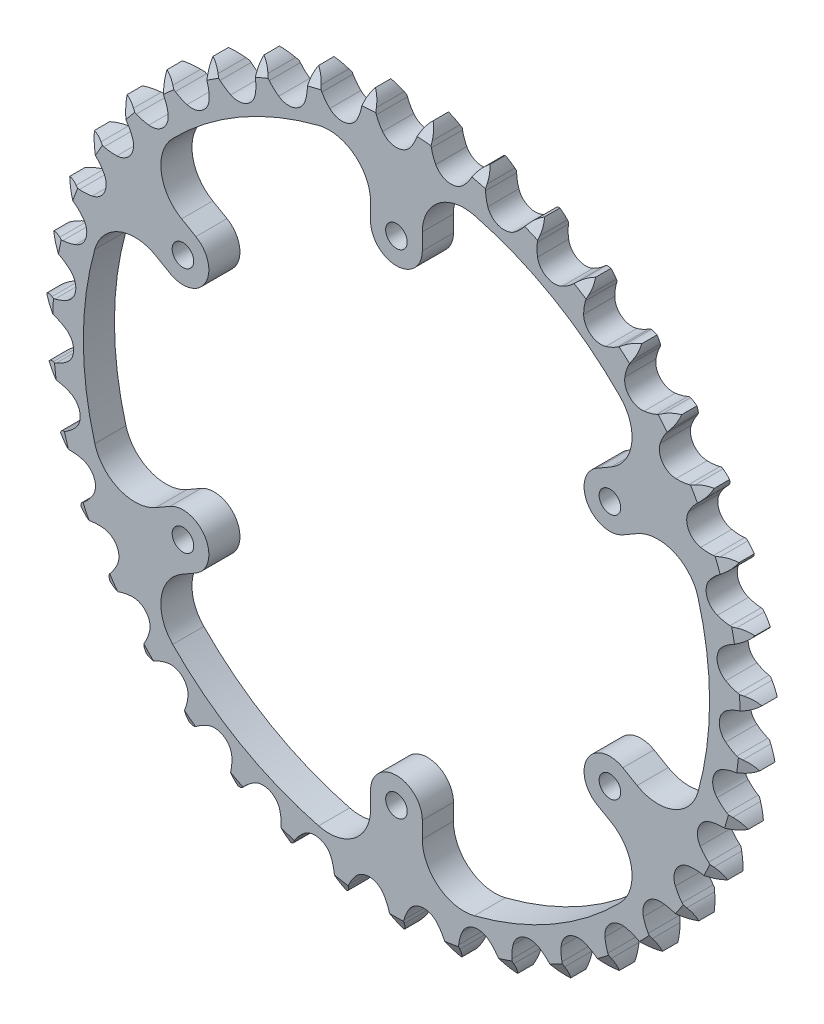
from build123d import *

# Parameters (mm, degrees)
EXTRUSION_DEPTH         = 7.2136
CUT_EXTRUDE_DEPTH       = 118.514389318
CUT_EXTRUDE_DEPTH_BACK  = 118.514389318
SKETCH1_R               = 72.594294032
BOSS_EXTRUDE_DEPTH      = 7.2136
M5_COUNTER_BORE_D       = 5
BOLT_HOLE_PATTERN_COUNT = 6
SKETCH6_R               = 5
CUT_EXTRUDE1_DEPTH      = 1.5
CIRPATTERN1_COUNT       = 6


with BuildPart() as part:
    # Teeth Sketch → Extrusion (new body)
    with BuildSketch(Plane.XY):
        with BuildLine():
            ThreePointArc((6.676484762, 82.703103732), (5.710873677, 81.555589606), (5.037571935, 80.215493266))
            Line((5.037571935, 80.215493266), (4.65053543, 79.150636707))
            ThreePointArc((4.65053543, 79.150636707), (4.030589042, 77.787636082), (3.22092759, 76.5280518))
            ThreePointArc((3.22092759, 76.5280518), (0, 74.905926143), (-3.22092759, 76.5280518))
            ThreePointArc((-3.22092759, 76.5280518), (-4.030589042, 77.787636082), (-4.65053543, 79.150636707))
            Line((-4.65053543, 79.150636707), (-5.037571935, 80.215493266))
            ThreePointArc((-5.037571935, 80.215493266), (-5.710873677, 81.555589606), (-6.676484762, 82.703103732))
            ThreePointArc((-6.676484762, 82.703103732), (-7.445517227, 81.415554702), (-7.895133318, 79.984807062))
            Line((-7.895133318, 79.984807062), (-8.106342797, 78.871655094))
            ThreePointArc((-8.106342797, 78.871655094), (-8.499620367, 77.426858575), (-9.096745387, 76.053706749))
            ThreePointArc((-9.096745387, 76.053706749), (-12.015755556, 73.935914073), (-15.455180235, 75.020360508))
            ThreePointArc((-15.455180235, 75.020360508), (-16.456408311, 76.133754674), (-17.286967233, 77.379658404))
            Line((-17.286967233, 77.379658404), (-17.83980672, 78.368640329))
            ThreePointArc((-17.83980672, 78.368640329), (-18.719355953, 79.583377579), (-19.856536839, 80.561136787))
            ThreePointArc((-19.856536839, 80.561136787), (-20.409073146, 79.166899696), (-20.623358765, 77.682556369))
            Line((-20.623358765, 77.682556369), (-20.653271004, 76.549939044))
            ThreePointArc((-20.653271004, 76.549939044), (-20.809694072, 75.060766102), (-21.178817437, 73.609610642))
            ThreePointArc((-21.178817437, 73.609610642), (-23.720309356, 71.051000665), (-27.289151829, 71.569681286))
            ThreePointArc((-27.289151829, 71.569681286), (-28.456015249, 72.508049011), (-29.475675664, 73.604587595))
            Line((-29.475675664, 73.604587595), (-30.179999883, 74.492080773))
            ThreePointArc((-30.179999883, 74.492080773), (-31.243016742, 75.549997876), (-32.522315041, 76.332678717))
            ThreePointArc((-32.522315041, 76.332678717), (-32.844044791, 74.867863573), (-32.817450053, 73.368368272))
            Line((-32.817450053, 73.368368272), (-32.66529034, 72.245619783))
            ThreePointArc((-32.66529034, 72.245619783), (-32.580807632, 70.750639215), (-32.71236924, 69.259064285))
            ThreePointArc((-32.71236924, 69.259064285), (-34.810519602, 66.325903661), (-38.416348726, 66.265384911))
            ThreePointArc((-38.416348726, 66.265384911), (-39.71862634, 67.004422965), (-40.900979579, 67.923196629))
            Line((-40.900979579, 67.923196629), (-41.738546902, 68.686215454))
            ThreePointArc((-41.738546902, 68.686215454), (-42.957499809, 69.559912912), (-44.345782367, 70.127244363))
            ThreePointArc((-44.345782367, 70.127244363), (-44.428372928, 68.629789109), (-44.161586623, 67.153977974))
            Line((-44.161586623, 67.153977974), (-43.831295815, 66.070176918))
            ThreePointArc((-43.831295815, 66.070176918), (-43.508095388, 64.608107935), (-43.398687863, 63.114744543))
            ThreePointArc((-43.398687863, 63.114744543), (-44.999155676, 59.883000591), (-48.54858237, 59.244849876))
            ThreePointArc((-48.54858237, 59.244849876), (-49.952545871, 59.765417561), (-51.266969607, 60.48263055))
            Line((-51.266969607, 60.48263055), (-52.21608748, 61.101413234))
            ThreePointArc((-52.21608748, 61.101413234), (-53.559406195, 61.768262742), (-55.020717224, 62.105551216))
            ThreePointArc((-55.020717224, 62.105551216), (-54.862029543, 60.614239157), (-54.361961296, 59.200334922))
            Line((-54.361961296, 59.200334922), (-53.862093752, 58.183551176))
            ThreePointArc((-53.862093752, 58.183551176), (-53.308546327, 56.792260597), (-52.961003266, 55.335786069))
            ThreePointArc((-52.961003266, 55.335786069), (-54.022337255, 51.889159262), (-57.423433231, 50.689904348))
            ThreePointArc((-57.423433231, 50.689904348), (-58.892720703, 50.978519235), (-60.305172051, 51.475596109))
            Line((-60.305172051, 51.475596109), (-61.34125882, 51.934116506))
            ThreePointArc((-61.34125882, 51.934116506), (-62.774152094, 52.376847013), (-64.270644405, 52.475356916))
            ThreePointArc((-64.270644405, 52.475356916), (-63.87478841, 51.02881225), (-63.154389727, 49.713434291))
            Line((-63.154389727, 49.713434291), (-62.497891753, 48.790002021))
            ThreePointArc((-62.497891753, 48.790002021), (-61.728333918, 47.505523541), (-61.151656504, 46.123659804))
            ThreePointArc((-61.151656504, 46.123659804), (-61.646368676, 42.551415963), (-64.811047336, 40.822116924))
            ThreePointArc((-64.811047336, 40.822116924), (-66.307605004, 40.871304038), (-67.781502216, 41.135370767))
            Line((-67.781502216, 41.135370767), (-68.877723777, 41.42175344))
            ThreePointArc((-68.877723777, 41.42175344), (-70.363080428, 41.628898458), (-71.855995657, 41.486078435))
            ThreePointArc((-71.855995657, 41.486078435), (-71.23322381, 40.12176591), (-70.311152637, 38.938981826))
            Line((-70.311152637, 38.938981826), (-69.515027187, 38.132817442))
            ThreePointArc((-69.515027187, 38.132817442), (-68.549390085, 36.988418379), (-67.75851396, 35.716954977))
            ThreePointArc((-67.75851396, 35.716954977), (-67.673791529, 32.111613343), (-70.520089358, 29.897058114))
            ThreePointArc((-70.520089358, 29.897058114), (-72.005157166, 29.705543536), (-73.502327078, 29.729760931))
            Line((-73.502327078, 29.729760931), (-74.630291869, 29.836588719))
            ThreePointArc((-74.630291869, 29.836588719), (-76.129641939, 29.8027833), (-77.580314364, 29.422332315))
            ThreePointArc((-77.580314364, 29.422332315), (-76.74675613, 28.175586908), (-75.646893627, 27.156030185))
            Line((-75.646893627, 27.156030185), (-74.731759931, 26.488012922))
            ThreePointArc((-74.731759931, 26.488012922), (-73.595053056, 25.51333261), (-72.610461496, 24.385199777))
            ThreePointArc((-72.610461496, 24.385199777), (-71.948498729, 20.840136804), (-74.402698108, 18.197681204))
            ThreePointArc((-74.402698108, 18.197681204), (-75.837813579, 17.77042506), (-77.319480277, 17.554165902))
            Line((-77.319480277, 17.554165902), (-78.449974603, 17.478672021))
            ThreePointArc((-78.449974603, 17.478672021), (-79.924485713, 17.204791709), (-81.295343681, 16.596563242))
            ThreePointArc((-81.295343681, 16.596563242), (-80.27258778, 15.499675005), (-79.023419807, 14.669751627))
            Line((-79.023419807, 14.669751627), (-78.012979347, 14.15718278))
            ThreePointArc((-78.012979347, 14.15718278), (-76.734642811, 13.377464928), (-75.58183622, 12.421880712))
            ThreePointArc((-75.58183622, 12.421880712), (-74.359777605, 9.028911669), (-76.358316059, 6.026993909))
            ThreePointArc((-76.358316059, 6.026993909), (-77.706310456, 5.375061909), (-79.134099551, 4.923927198))
            Line((-79.134099551, 4.923927198), (-80.237844202, 4.6680669))
            ThreePointArc((-80.237844202, 4.6680669), (-81.649327289, 4.161205049), (-82.904866299, 3.340951899))
            ThreePointArc((-82.904866299, 3.340951899), (-81.719401571, 2.422329661), (-80.353280924, 1.803534207))
            Line((-80.353280924, 1.803534207), (-79.273703577, 1.45968904))
            ThreePointArc((-79.273703577, 1.45968904), (-77.886845624, 0.895127931), (-76.595681088, 0.136841462))
            ThreePointArc((-76.595681088, 0.136841462), (-74.8451773, -3.016157536), (-76.336293733, -6.299789363))
            ThreePointArc((-76.336293733, -6.299789363), (-77.56225471, -7.159512522), (-78.899187214, -7.833838635))
            Line((-78.899187214, -7.833838635), (-79.947595784, -8.263438702))
            ThreePointArc((-79.947595784, -8.263438702), (-81.259494176, -8.990154635), (-82.367196428, -10.001188343))
            ThreePointArc((-82.367196428, -10.001188343), (-81.049725787, -10.717752749), (-79.602034272, -11.109393802))
            Line((-79.602034272, -11.109393802), (-78.481280524, -11.275609878))
            ThreePointArc((-78.481280524, -11.275609878), (-77.021820047, -11.610392409), (-75.625738049, -12.151741911))
            ThreePointArc((-75.625738049, -12.151741911), (-73.392126218, -14.983109845), (-74.337201497, -18.463411399))
            ThreePointArc((-74.337201497, -18.463411399), (-75.409377308, -19.50865934), (-76.620827372, -20.388712162))
            Line((-76.620827372, -20.388712162), (-77.586746629, -20.980925582))
            ThreePointArc((-77.586746629, -20.980925582), (-78.765082849, -21.908674036), (-79.696259435, -23.08430306))
            ThreePointArc((-79.696259435, -23.08430306), (-78.280904679, -23.580250992), (-76.789136745, -23.734594346))
            Line((-76.789136745, -23.734594346), (-75.656233531, -23.718876424))
            ThreePointArc((-75.656233531, -23.718876424), (-74.161969788, -23.815209685), (-72.697128119, -24.125601551))
            ThreePointArc((-72.697128119, -24.125601551), (-70.038257617, -26.562007479), (-70.41281479, -30.148840778))
            ThreePointArc((-70.41281479, -30.148840778), (-71.303436645, -31.352542128), (-72.358028349, -32.415528753))
            Line((-72.358028349, -32.415528753), (-73.216441492, -33.155017511))
            ThreePointArc((-73.216441492, -33.155017511), (-74.230697248, -34.259770288), (-74.961231185, -35.569546454))
            ThreePointArc((-74.961231185, -35.569546454), (-73.484649258, -35.832033121), (-71.987440912, -35.745081364))
            Line((-71.987440912, -35.745081364), (-70.871729829, -35.547836529))
            ThreePointArc((-70.871729829, -35.547836529), (-69.381363468, -35.403225539), (-67.885700756, -35.474620783))
            ThreePointArc((-67.885700756, -35.474620783), (-64.870434934, -37.452963072), (-64.664773166, -41.053431017))
            ThreePointArc((-64.664773166, -41.053431017), (-65.350774426, -42.384410543), (-66.221194398, -43.602800177))
            Line((-66.221194398, -43.602800177), (-66.949868978, -44.470411902))
            ThreePointArc((-66.949868978, -44.470411902), (-67.773775581, -45.723556485), (-68.284746423, -47.133557278))
            ThreePointArc((-68.284746423, -47.133557278), (-66.785180021, -47.155784414), (-65.321308173, -46.829789551))
            Line((-65.321308173, -46.829789551), (-64.251685552, -46.456126341))
            ThreePointArc((-64.251685552, -46.456126341), (-62.803816278, -46.074316448), (-61.316069403, -45.904865971))
            ThreePointArc((-61.316069403, -45.904865971), (-58.022502061, -47.373906594), (-57.241947884, -50.894758957))
            ThreePointArc((-57.241947884, -50.894758957), (-57.705561477, -52.318544989), (-58.369266298, -53.66078198))
            Line((-58.369266298, -53.66078198), (-58.949330025, -54.634045983))
            ThreePointArc((-58.949330025, -54.634045983), (-59.561548726, -56.003126587), (-59.839722596, -57.476833727))
            ThreePointArc((-59.839722596, -57.476833727), (-58.356009703, -57.25822566), (-56.963387864, -56.701630787))
            Line((-56.963387864, -56.701630787), (-55.967556369, -56.161226883))
            ThreePointArc((-55.967556369, -56.161226883), (-54.599683236, -55.552106762), (-53.15838406, -55.146199243))
            ThreePointArc((-53.15838406, -55.146199243), (-49.671816862, -56.06789082), (-48.336586219, -59.417939375))
            ThreePointArc((-48.336586219, -59.417939375), (-48.565804798, -60.897656602), (-49.00560486, -62.328977716))
            Line((-49.00560486, -62.328977716), (-49.422034389, -63.382686971))
            ThreePointArc((-49.422034389, -63.382686971), (-49.806709045, -64.832245127), (-49.844881387, -66.331490374))
            ThreePointArc((-49.844881387, -66.331490374), (-48.415449386, -65.877708938), (-47.130145731, -65.104929569))
            Line((-47.130145731, -65.104929569), (-46.233896874, -64.411781148))
            ThreePointArc((-46.233896874, -64.411781148), (-44.981447078, -63.591126692), (-43.623924493, -62.959274922))
            ThreePointArc((-43.623924493, -62.959274922), (-40.034657698, -63.309746125), (-38.179332362, -66.402226373))
            ThreePointArc((-38.179332362, -66.402226373), (-38.168219284, -67.899550896), (-38.372723998, -69.38288567))
            Line((-38.372723998, -69.38288567), (-38.614734022, -70.489749661))
            ThreePointArc((-38.614734022, -70.489749661), (-38.761901763, -71.982242573), (-38.559083932, -73.468196262))
            ThreePointArc((-38.559083932, -73.468196262), (-37.220954361, -72.790994159), (-36.076257579, -71.822044874))
            Line((-36.076257579, -71.822044874), (-35.302803736, -70.994104116))
            ThreePointArc((-35.302803736, -70.994104116), (-34.198215068, -69.983169844), (-32.959628196, -69.141738451))
            ThreePointArc((-32.959628196, -69.141738451), (-29.360621929, -68.91191226), (-27.033253851, -71.666730588))
            ThreePointArc((-27.033253851, -71.666730588), (-26.78209694, -73.142882488), (-26.74600974, -74.639813329))
            Line((-26.74600974, -74.639813329), (-26.807332328, -75.77116486))
            ThreePointArc((-26.807332328, -75.77116486), (-26.713181585, -77.267937748), (-26.274626458, -78.702114459))
            ThreePointArc((-26.274626458, -78.702114459), (-25.06245617, -77.819030866), (-24.088013307, -76.679006943))
            Line((-24.088013307, -76.679006943), (-23.457386525, -75.737717079))
            ThreePointArc((-23.457386525, -75.737717079), (-22.529267252, -74.562685657), (-21.441694841, -73.533467273))
            ThreePointArc((-21.441694841, -73.533467273), (-17.926161474, -72.729296065), (-15.187028265, -75.075104125))
            ThreePointArc((-15.187028265, -75.075104125), (-14.702332353, -76.491851845), (-14.426587879, -77.96360903))
            Line((-14.426587879, -77.96360903), (-14.305634807, -79.090146691))
            ThreePointArc((-14.305634807, -79.090146691), (-13.972604036, -80.552433921), (-13.309669959, -81.897689231))
            ThreePointArc((-13.309669959, -81.897689231), (-12.254853529, -80.83159555), (-11.475902142, -79.55002301))
            Line((-11.475902142, -79.55002301), (-11.004435324, -78.519762952))
            ThreePointArc((-11.004435324, -78.519762952), (-10.276823247, -77.211067077), (-9.368432854, -76.020717918))
            ThreePointArc((-9.368432854, -76.020717918), (-6.027422853, -74.663029306), (-2.947466624, -76.5390719))
            ThreePointArc((-2.947466624, -76.5390719), (-2.241785081, -77.859722417), (-1.733524971, -79.26818821))
            Line((-1.733524971, -79.26818821), (-1.43342886, -80.360735266))
            ThreePointArc((-1.43342886, -80.360735266), (-0.870143382, -81.750664368), (0, -82.97215687))
            ThreePointArc((0, -82.97215687), (0.870143382, -81.750664368), (1.43342886, -80.360735266))
            Line((1.43342886, -80.360735266), (1.733524971, -79.26818821))
            ThreePointArc((1.733524971, -79.26818821), (2.241785081, -77.859722417), (2.947466624, -76.5390719))
            ThreePointArc((2.947466624, -76.5390719), (6.027422853, -74.663029306), (9.368432854, -76.020717918))
            ThreePointArc((9.368432854, -76.020717918), (10.276823247, -77.211067077), (11.004435324, -78.519762952))
            Line((11.004435324, -78.519762952), (11.475902142, -79.55002301))
            ThreePointArc((11.475902142, -79.55002301), (12.254853529, -80.83159555), (13.309669959, -81.897689231))
            ThreePointArc((13.309669959, -81.897689231), (13.972604036, -80.552433921), (14.305634807, -79.090146691))
            Line((14.305634807, -79.090146691), (14.426587879, -77.96360903))
            ThreePointArc((14.426587879, -77.96360903), (14.702332353, -76.491851845), (15.187028265, -75.075104125))
            ThreePointArc((15.187028265, -75.075104125), (17.926161474, -72.729296065), (21.441694841, -73.533467273))
            ThreePointArc((21.441694841, -73.533467273), (22.529267252, -74.562685657), (23.457386525, -75.737717079))
            Line((23.457386525, -75.737717079), (24.088013307, -76.679006943))
            ThreePointArc((24.088013307, -76.679006943), (25.06245617, -77.819030866), (26.274626458, -78.702114459))
            ThreePointArc((26.274626458, -78.702114459), (26.713181585, -77.267937748), (26.807332328, -75.77116486))
            Line((26.807332328, -75.77116486), (26.74600974, -74.639813329))
            ThreePointArc((26.74600974, -74.639813329), (26.78209694, -73.142882488), (27.033253851, -71.666730588))
            ThreePointArc((27.033253851, -71.666730588), (29.360621929, -68.91191226), (32.959628196, -69.141738451))
            ThreePointArc((32.959628196, -69.141738451), (34.198215068, -69.983169844), (35.302803736, -70.994104116))
            Line((35.302803736, -70.994104116), (36.076257579, -71.822044874))
            ThreePointArc((36.076257579, -71.822044874), (37.220954361, -72.790994159), (38.559083932, -73.468196262))
            ThreePointArc((38.559083932, -73.468196262), (38.761901763, -71.982242573), (38.614734022, -70.489749661))
            Line((38.614734022, -70.489749661), (38.372723998, -69.38288567))
            ThreePointArc((38.372723998, -69.38288567), (38.168219284, -67.899550896), (38.179332362, -66.402226373))
            ThreePointArc((38.179332362, -66.402226373), (40.034657698, -63.309746125), (43.623924493, -62.959274922))
            ThreePointArc((43.623924493, -62.959274922), (44.981447078, -63.591126692), (46.233896874, -64.411781148))
            Line((46.233896874, -64.411781148), (47.130145731, -65.104929569))
            ThreePointArc((47.130145731, -65.104929569), (48.415449386, -65.877708938), (49.844881387, -66.331490374))
            ThreePointArc((49.844881387, -66.331490374), (49.806709045, -64.832245127), (49.422034389, -63.382686971))
            Line((49.422034389, -63.382686971), (49.00560486, -62.328977716))
            ThreePointArc((49.00560486, -62.328977716), (48.565804798, -60.897656602), (48.336586219, -59.417939375))
            ThreePointArc((48.336586219, -59.417939375), (49.671816862, -56.06789082), (53.15838406, -55.146199243))
            ThreePointArc((53.15838406, -55.146199243), (54.599683236, -55.552106762), (55.967556369, -56.161226883))
            Line((55.967556369, -56.161226883), (56.963387864, -56.701630787))
            ThreePointArc((56.963387864, -56.701630787), (58.356009703, -57.25822566), (59.839722596, -57.476833727))
            ThreePointArc((59.839722596, -57.476833727), (59.561548726, -56.003126587), (58.949330025, -54.634045983))
            Line((58.949330025, -54.634045983), (58.369266298, -53.66078198))
            ThreePointArc((58.369266298, -53.66078198), (57.705561477, -52.318544989), (57.241947884, -50.894758957))
            ThreePointArc((57.241947884, -50.894758957), (58.022502061, -47.373906594), (61.316069403, -45.904865971))
            ThreePointArc((61.316069403, -45.904865971), (62.803816278, -46.074316448), (64.251685552, -46.456126341))
            Line((64.251685552, -46.456126341), (65.321308173, -46.829789551))
            ThreePointArc((65.321308173, -46.829789551), (66.785180021, -47.155784414), (68.284746423, -47.133557278))
            ThreePointArc((68.284746423, -47.133557278), (67.773775581, -45.723556485), (66.949868978, -44.470411902))
            Line((66.949868978, -44.470411902), (66.221194398, -43.602800177))
            ThreePointArc((66.221194398, -43.602800177), (65.350774426, -42.384410543), (64.664773166, -41.053431017))
            ThreePointArc((64.664773166, -41.053431017), (64.870434934, -37.452963072), (67.885700756, -35.474620783))
            ThreePointArc((67.885700756, -35.474620783), (69.381363468, -35.403225539), (70.871729829, -35.547836529))
            Line((70.871729829, -35.547836529), (71.987440912, -35.745081364))
            ThreePointArc((71.987440912, -35.745081364), (73.484649258, -35.832033121), (74.961231185, -35.569546454))
            ThreePointArc((74.961231185, -35.569546454), (74.230697248, -34.259770288), (73.216441492, -33.155017511))
            Line((73.216441492, -33.155017511), (72.358028349, -32.415528753))
            ThreePointArc((72.358028349, -32.415528753), (71.303436645, -31.352542128), (70.41281479, -30.148840778))
            ThreePointArc((70.41281479, -30.148840778), (70.038257617, -26.562007479), (72.697128119, -24.125601551))
            ThreePointArc((72.697128119, -24.125601551), (74.161969788, -23.815209685), (75.656233531, -23.718876424))
            Line((75.656233531, -23.718876424), (76.789136745, -23.734594346))
            ThreePointArc((76.789136745, -23.734594346), (78.280904679, -23.580250992), (79.696259435, -23.08430306))
            ThreePointArc((79.696259435, -23.08430306), (78.765082849, -21.908674036), (77.586746629, -20.980925582))
            Line((77.586746629, -20.980925582), (76.620827372, -20.388712162))
            ThreePointArc((76.620827372, -20.388712162), (75.409377308, -19.50865934), (74.337201497, -18.463411399))
            ThreePointArc((74.337201497, -18.463411399), (73.392126218, -14.983109845), (75.625738049, -12.151741911))
            ThreePointArc((75.625738049, -12.151741911), (77.021820047, -11.610392409), (78.481280524, -11.275609878))
            Line((78.481280524, -11.275609878), (79.602034272, -11.109393802))
            ThreePointArc((79.602034272, -11.109393802), (81.049725787, -10.717752749), (82.367196428, -10.001188343))
            ThreePointArc((82.367196428, -10.001188343), (81.259494176, -8.990154635), (79.947595784, -8.263438702))
            Line((79.947595784, -8.263438702), (78.899187214, -7.833838635))
            ThreePointArc((78.899187214, -7.833838635), (77.56225471, -7.159512522), (76.336293733, -6.299789363))
            ThreePointArc((76.336293733, -6.299789363), (74.8451773, -3.016157536), (76.595681088, 0.136841462))
            ThreePointArc((76.595681088, 0.136841462), (77.886845624, 0.895127931), (79.273703577, 1.45968904))
            Line((79.273703577, 1.45968904), (80.353280924, 1.803534207))
            ThreePointArc((80.353280924, 1.803534207), (81.719401571, 2.422329661), (82.904866299, 3.340951899))
            ThreePointArc((82.904866299, 3.340951899), (81.649327289, 4.161205049), (80.237844202, 4.6680669))
            Line((80.237844202, 4.6680669), (79.134099551, 4.923927198))
            ThreePointArc((79.134099551, 4.923927198), (77.706310456, 5.375061909), (76.358316059, 6.026993909))
            ThreePointArc((76.358316059, 6.026993909), (74.359777605, 9.028911669), (75.58183622, 12.421880712))
            ThreePointArc((75.58183622, 12.421880712), (76.734642811, 13.377464928), (78.012979347, 14.15718278))
            Line((78.012979347, 14.15718278), (79.023419807, 14.669751627))
            ThreePointArc((79.023419807, 14.669751627), (80.27258778, 15.499675005), (81.295343681, 16.596563242))
            ThreePointArc((81.295343681, 16.596563242), (79.924485713, 17.204791709), (78.449974603, 17.478672021))
            Line((78.449974603, 17.478672021), (77.319480277, 17.554165902))
            ThreePointArc((77.319480277, 17.554165902), (75.837813579, 17.77042506), (74.402698108, 18.197681204))
            ThreePointArc((74.402698108, 18.197681204), (71.948498729, 20.840136804), (72.610461496, 24.385199777))
            ThreePointArc((72.610461496, 24.385199777), (73.595053056, 25.51333261), (74.731759931, 26.488012922))
            Line((74.731759931, 26.488012922), (75.646893627, 27.156030185))
            ThreePointArc((75.646893627, 27.156030185), (76.74675613, 28.175586908), (77.580314364, 29.422332315))
            ThreePointArc((77.580314364, 29.422332315), (76.129641939, 29.8027833), (74.630291869, 29.836588719))
            Line((74.630291869, 29.836588719), (73.502327078, 29.729760931))
            ThreePointArc((73.502327078, 29.729760931), (72.005157166, 29.705543536), (70.520089358, 29.897058114))
            ThreePointArc((70.520089358, 29.897058114), (67.673791529, 32.111613343), (67.75851396, 35.716954977))
            ThreePointArc((67.75851396, 35.716954977), (68.549390085, 36.988418379), (69.515027187, 38.132817442))
            Line((69.515027187, 38.132817442), (70.311152637, 38.938981826))
            ThreePointArc((70.311152637, 38.938981826), (71.23322381, 40.12176591), (71.855995657, 41.486078435))
            ThreePointArc((71.855995657, 41.486078435), (70.363080428, 41.628898458), (68.877723777, 41.42175344))
            Line((68.877723777, 41.42175344), (67.781502216, 41.135370767))
            ThreePointArc((67.781502216, 41.135370767), (66.307605004, 40.871304038), (64.811047336, 40.822116924))
            ThreePointArc((64.811047336, 40.822116924), (61.646368676, 42.551415963), (61.151656504, 46.123659804))
            ThreePointArc((61.151656504, 46.123659804), (61.728333918, 47.505523541), (62.497891753, 48.790002021))
            Line((62.497891753, 48.790002021), (63.154389727, 49.713434291))
            ThreePointArc((63.154389727, 49.713434291), (63.87478841, 51.02881225), (64.270644405, 52.475356916))
            ThreePointArc((64.270644405, 52.475356916), (62.774152094, 52.376847013), (61.34125882, 51.934116506))
            Line((61.34125882, 51.934116506), (60.305172051, 51.475596109))
            ThreePointArc((60.305172051, 51.475596109), (58.892720703, 50.978519235), (57.423433231, 50.689904348))
            ThreePointArc((57.423433231, 50.689904348), (54.022337255, 51.889159262), (52.961003266, 55.335786069))
            ThreePointArc((52.961003266, 55.335786069), (53.308546327, 56.792260597), (53.862093752, 58.183551176))
            Line((53.862093752, 58.183551176), (54.361961296, 59.200334922))
            ThreePointArc((54.361961296, 59.200334922), (54.862029543, 60.614239157), (55.020717224, 62.105551216))
            ThreePointArc((55.020717224, 62.105551216), (53.559406195, 61.768262742), (52.21608748, 61.101413234))
            Line((52.21608748, 61.101413234), (51.266969607, 60.48263055))
            ThreePointArc((51.266969607, 60.48263055), (49.952545871, 59.765417561), (48.54858237, 59.244849876))
            ThreePointArc((48.54858237, 59.244849876), (44.999155676, 59.883000591), (43.398687863, 63.114744543))
            ThreePointArc((43.398687863, 63.114744543), (43.508095388, 64.608107935), (43.831295815, 66.070176918))
            Line((43.831295815, 66.070176918), (44.161586623, 67.153977974))
            ThreePointArc((44.161586623, 67.153977974), (44.428372928, 68.629789109), (44.345782367, 70.127244363))
            ThreePointArc((44.345782367, 70.127244363), (42.957499809, 69.559912912), (41.738546902, 68.686215454))
            Line((41.738546902, 68.686215454), (40.900979579, 67.923196629))
            ThreePointArc((40.900979579, 67.923196629), (39.71862634, 67.004422965), (38.416348726, 66.265384911))
            ThreePointArc((38.416348726, 66.265384911), (34.810519602, 66.325903661), (32.71236924, 69.259064285))
            ThreePointArc((32.71236924, 69.259064285), (32.580807632, 70.750639215), (32.66529034, 72.245619783))
            Line((32.66529034, 72.245619783), (32.817450053, 73.368368272))
            ThreePointArc((32.817450053, 73.368368272), (32.844044791, 74.867863573), (32.522315041, 76.332678717))
            ThreePointArc((32.522315041, 76.332678717), (31.243016742, 75.549997876), (30.179999883, 74.492080773))
            Line((30.179999883, 74.492080773), (29.475675664, 73.604587595))
            ThreePointArc((29.475675664, 73.604587595), (28.456015249, 72.508049011), (27.289151829, 71.569681286))
            ThreePointArc((27.289151829, 71.569681286), (23.720309356, 71.051000665), (21.178817437, 73.609610642))
            ThreePointArc((21.178817437, 73.609610642), (20.809694072, 75.060766102), (20.653271004, 76.549939044))
            Line((20.653271004, 76.549939044), (20.623358765, 77.682556369))
            ThreePointArc((20.623358765, 77.682556369), (20.409073146, 79.166899696), (19.856536839, 80.561136787))
            ThreePointArc((19.856536839, 80.561136787), (18.719355953, 79.583377579), (17.83980672, 78.368640329))
            Line((17.83980672, 78.368640329), (17.286967233, 77.379658404))
            ThreePointArc((17.286967233, 77.379658404), (16.456408311, 76.133754674), (15.455180235, 75.020360508))
            ThreePointArc((15.455180235, 75.020360508), (12.015755556, 73.935914073), (9.096745387, 76.053706749))
            ThreePointArc((9.096745387, 76.053706749), (8.499620367, 77.426858575), (8.106342797, 78.871655094))
            Line((8.106342797, 78.871655094), (7.895133318, 79.984807062))
            ThreePointArc((7.895133318, 79.984807062), (7.445517227, 81.415554702), (6.676484762, 82.703103732))
        make_face()
    extrude(amount=EXTRUSION_DEPTH)

    # Sketch1 → Cut-Extrude (cut, two sides: drawn at the far end of the back side and taken through both)
    with BuildSketch(Plane(origin=(0, 0, 0), x_dir=(-1, 0, 0), z_dir=(0, 0, -1)).offset(-CUT_EXTRUDE_DEPTH_BACK)):
        Circle(SKETCH1_R)
    extrude(amount=CUT_EXTRUDE_DEPTH + CUT_EXTRUDE_DEPTH_BACK, mode=Mode.SUBTRACT)

    # Sketch2 → Boss-Extrude (add)
    with BuildSketch(Plane(origin=(0, 0, 0), x_dir=(-1, 0, 0), z_dir=(0, 0, -1))):
        with BuildLine():
            ThreePointArc((-6, 57.15), (0, 51.15), (6, 57.15))
            Line((6, 57.15), (6, 60.965131625))
            ThreePointArc((6, 60.965131625), (9.736151564, 68.591653852), (18.052184269, 70.313940077))
            ThreePointArc((18.052184269, 70.313940077), (0, 72.594294032), (-18.052184269, 70.313940077))
            ThreePointArc((-18.052184269, 70.313940077), (-9.736151564, 68.591653852), (-6, 60.965131625))
            Line((-6, 60.965131625), (-6, 57.15))
        make_face()
    boss_extrude = extrude(amount=-BOSS_EXTRUDE_DEPTH)

    # M5 Counter Bore (through all)
    with Locations(Plane(origin=(0, 0, 0), x_dir=(-1, 0, 0), z_dir=(0, 0, -1))):
        with Locations((0, 57.15)):
            m5_counter_bore = Hole(M5_COUNTER_BORE_D / 2)

    # Bolt Hole Pattern: Boss-Extrude, M5 Counter Bore ×6 about axis
    bolt_hole_pattern_axis = Axis((0, 0, 0), (0, 0, 1))
    add([boss_extrude.rotate(bolt_hole_pattern_axis, i * 360 / BOLT_HOLE_PATTERN_COUNT) for i in range(1, BOLT_HOLE_PATTERN_COUNT)])
    add([m5_counter_bore.rotate(bolt_hole_pattern_axis, i * 360 / BOLT_HOLE_PATTERN_COUNT) for i in range(1, BOLT_HOLE_PATTERN_COUNT)], mode=Mode.SUBTRACT)

    # Sketch5 → Cut-Revolve1 (revolve, cut)
    with BuildSketch(Plane(origin=(0, 0, 0), x_dir=(0, 0, -1), z_dir=(1, 0, 0))):
        Polygon((-7.2136, -79.67015687), (-7.2136, -82.97215687), (-5.3848, -82.97215687), align=None)
    cut_revolve1 = revolve(axis=Axis((0, 0, 7.2136), (0, 0, -1)), mode=Mode.SUBTRACT)

    # Mirror1: Cut-Revolve1 across plane
    add(cut_revolve1.mirror(Plane.XY.offset(3.6068)), mode=Mode.SUBTRACT)

    # Sketch6 → Cut-Extrude1 (cut)
    with BuildSketch(Plane.XY):
        with Locations((0, 57.15)):
            Circle(SKETCH6_R)
    cut_extrude1 = extrude(amount=CUT_EXTRUDE1_DEPTH, mode=Mode.SUBTRACT)

    # CirPattern1: Cut-Extrude1 ×6 about axis
    cirpattern1_axis = Axis((0, 0, 0), (0, 0, 1))
    for i in range(1, CIRPATTERN1_COUNT):
        add(cut_extrude1.rotate(cirpattern1_axis, i * 360 / CIRPATTERN1_COUNT), mode=Mode.SUBTRACT)


solid = part.part
